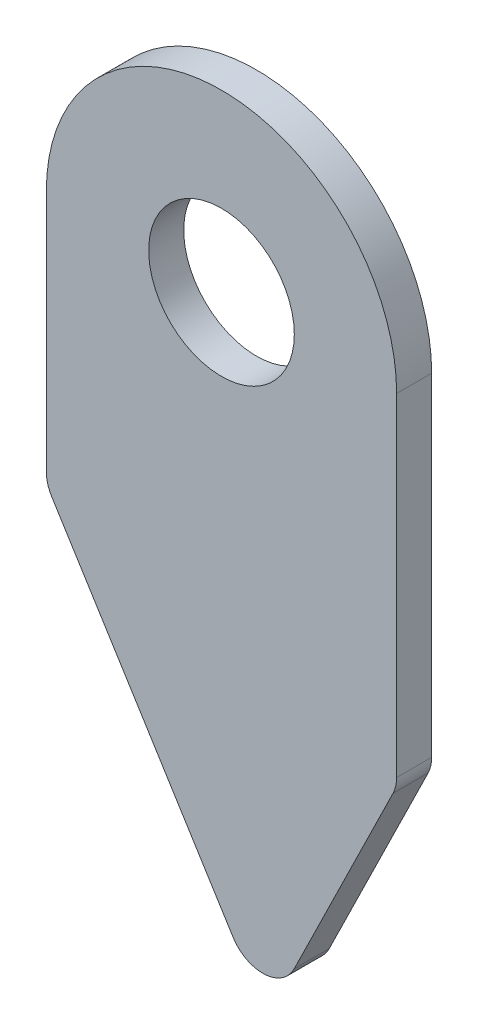
from build123d import *

# Parameters (mm, degrees)
BOSS_EXTRUDE1_DEPTH  = 1.5875
M6_CLEARANCE_HOLE1_D = 6.6
CUT_EXTRUDE1_DEPTH   = 30.699405508
FILLET1_R            = 1.5875


with BuildPart() as part:
    # Sketch1 → Boss-Extrude1 (new body)
    with BuildSketch(Plane.XY):
        with BuildLine():
            Line((7.9375, -28.575), (7.9375, 0))
            ThreePointArc((7.9375, 0), (0, 7.9375), (-7.9375, 0))
            Line((-7.9375, 0), (-7.9375, -28.575))
            Line((-7.9375, -28.575), (7.9375, -28.575))
        make_face()
    extrude(amount=BOSS_EXTRUDE1_DEPTH)

    # M6 Clearance Hole1 (through all)
    with Locations(Plane.XY.offset(1.5875)):
        with Locations((0, 0)):
            Hole(M6_CLEARANCE_HOLE1_D / 2)

    # Sketch4 → Cut-Extrude1 (cut, through all)
    with BuildSketch(Plane.XY.offset(1.5875)):
        Polygon((7.9375, -28.575), (7.9375, -15.441016157), (2.035744182, -27.468766371), (-7.9375, -11.475212377), (-7.9375, -28.575), align=None)
    extrude(amount=-CUT_EXTRUDE1_DEPTH, mode=Mode.SUBTRACT)

    # Fillet1
    fillet1_edges = [part.edges().sort_by_distance(p)[0] for p in [
        (7.9375, -15.441016157, 0.79375),
        (-7.9375, -11.475212377, 0.79375),
        (2.035744182, -27.468766371, 0.79375),
    ]]
    fillet(fillet1_edges, radius=FILLET1_R)


solid = part.part
